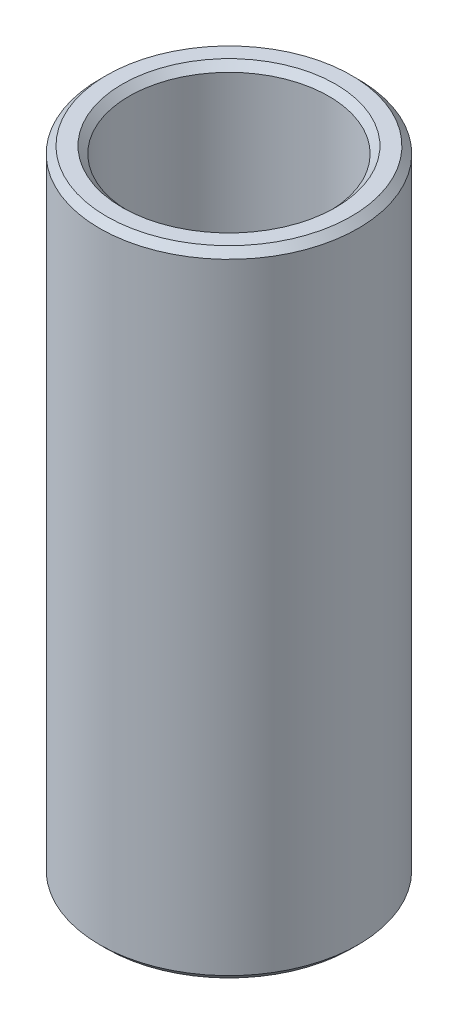
from build123d import *

# Parameters (mm, degrees)
SKETCH1_R           = 47.5
BOSS_EXTRUDE1_DEPTH = 233.052239229
SKETCH2_R           = 36.693899401
CUT_EXTRUDE1_DEPTH  = 243.540401191
CHAMFER1_SIZE       = 2.546712185


with BuildPart() as part:
    # Sketch1 → Boss-Extrude1 (new body)
    with BuildSketch(Plane(origin=(0, 0, 0), x_dir=(1, 0, 0), z_dir=(0, 1, 0))):
        Circle(SKETCH1_R)
    extrude(amount=BOSS_EXTRUDE1_DEPTH)

    # Sketch2 → Cut-Extrude1 (cut, through all)
    with BuildSketch(Plane(origin=(0, 0, 0), x_dir=(1, 0, 0), z_dir=(0, 1, 0))):
        Circle(SKETCH2_R)
    extrude(amount=CUT_EXTRUDE1_DEPTH, mode=Mode.SUBTRACT)

    # Chamfer1
    chamfer1_edges = [part.edges().sort_by_distance(p)[0] for p in [
        (-36.693899401, 233.052239229, 0),
        (-36.693899401, 0, 0),
        (-47.5, 0, 0),
        (-47.5, 233.052239229, 0),
    ]]
    chamfer(chamfer1_edges, length=CHAMFER1_SIZE)


solid = part.part
